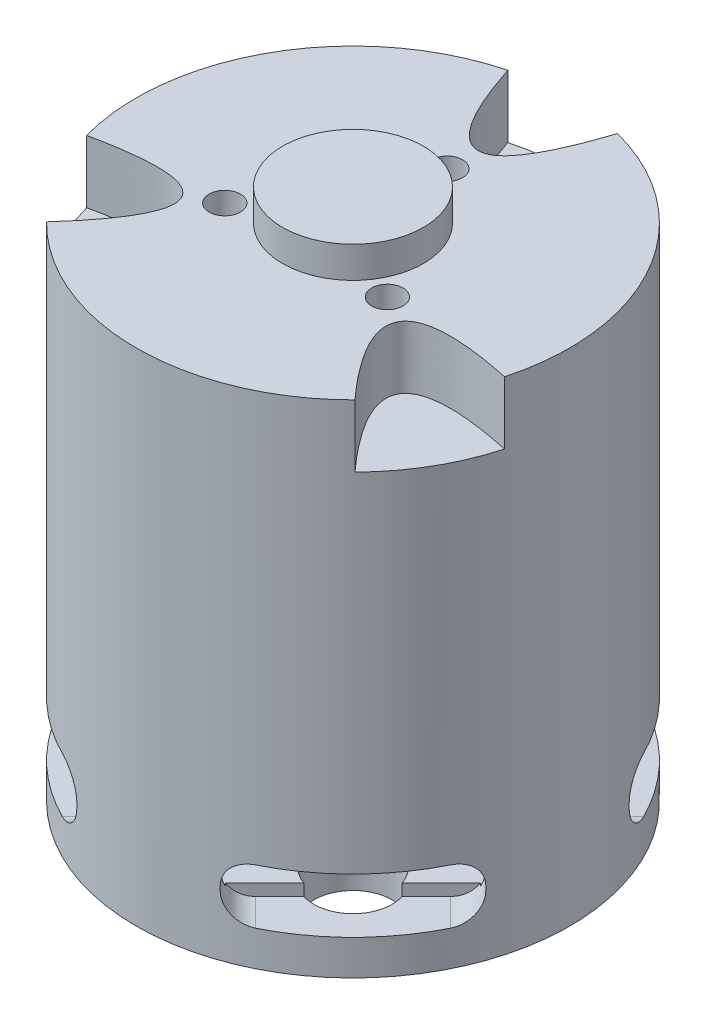
from build123d import *

# Parameters (mm, degrees)
SKETCH1_R           = 13.85
SKETCH1_R_2         = 1.5
SKETCH1_R_3         = 2.5
BOSS_EXTRUDE1_DEPTH = 3
SKETCH2_R           = 13.85
SKETCH2_R_2         = 12.35
BOSS_EXTRUDE2_DEPTH = 4
CUT_EXTRUDE1_DEPTH  = 3.2
CIRPATTERN1_COUNT   = 4
SKETCH4_R           = 13.85
BOSS_EXTRUDE3_DEPTH = 25
CUT_EXTRUDE2_START  = -4
SKETCH5_R           = 1
CUT_EXTRUDE2_DEPTH  = 4
SKETCH6_R           = 4.5
BOSS_EXTRUDE4_DEPTH = 2
SKETCH7_R           = 1.585
BOSS_EXTRUDE5_DEPTH = 2


with BuildPart() as part:
    # Sketch1 → Boss-Extrude1 (new body)
    with BuildSketch(Plane(origin=(0, 0, 0), x_dir=(1, 0, 0), z_dir=(0, 1, 0))):
        Circle(SKETCH1_R)
        with Locations((0, 8)):
            Circle(SKETCH1_R_2, mode=Mode.SUBTRACT)
        with Locations((-9.5, 0)):
            Circle(SKETCH1_R_2, mode=Mode.SUBTRACT)
        with Locations((-6.717514421, 6.717514421)):
            Circle(SKETCH1_R_3, mode=Mode.SUBTRACT)
        with Locations((6.717514421, 6.717514421)):
            Circle(SKETCH1_R_3, mode=Mode.SUBTRACT)
        with Locations((9.5, 0)):
            Circle(SKETCH1_R_2, mode=Mode.SUBTRACT)
        with Locations((6.717514421, -6.717514421)):
            Circle(SKETCH1_R_3, mode=Mode.SUBTRACT)
        with Locations((0, -8)):
            Circle(SKETCH1_R_2, mode=Mode.SUBTRACT)
        with Locations((-6.717514421, -6.717514421)):
            Circle(SKETCH1_R_3, mode=Mode.SUBTRACT)
    extrude(amount=BOSS_EXTRUDE1_DEPTH)

    # Sketch2 → Boss-Extrude2 (add)
    with BuildSketch(Plane(origin=(0, 3, 0), x_dir=(1, 0, 0), z_dir=(0, 1, 0))):
        Circle(SKETCH2_R)
        Circle(SKETCH2_R_2, mode=Mode.SUBTRACT)
    extrude(amount=BOSS_EXTRUDE2_DEPTH)

    # Sketch3 → Cut-Extrude1 (cut)
    with BuildSketch(Plane(origin=(-9.793428919, 0, 9.793428919), x_dir=(0, -1, 0), z_dir=(-0.7071067811865488, 0, 0.7071067811865464))):
        with BuildLine():
            Line((-4.15, 6), (-3.85, 6))
            ThreePointArc((-3.85, 6), (-2.71862915, 5.53137085), (-2.25, 4.4))
            Line((-2.25, 4.4), (-2.25, -4.4))
            ThreePointArc((-2.25, -4.4), (-2.71862915, -5.53137085), (-3.85, -6))
            Line((-3.85, -6), (-4.15, -6))
            ThreePointArc((-4.15, -6), (-5.28137085, -5.53137085), (-5.75, -4.4))
            Line((-5.75, -4.4), (-5.75, 4.4))
            ThreePointArc((-5.75, 4.4), (-5.28137085, 5.53137085), (-4.15, 6))
        make_face()
    cut_extrude1 = extrude(amount=-CUT_EXTRUDE1_DEPTH, mode=Mode.SUBTRACT)

    # CirPattern1: Cut-Extrude1 ×4 about axis
    cirpattern1_axis = Axis((0, 7, 0), (0, -1, 0))
    for i in range(1, CIRPATTERN1_COUNT):
        add(cut_extrude1.rotate(cirpattern1_axis, i * 360 / CIRPATTERN1_COUNT), mode=Mode.SUBTRACT)

    # Sketch4 → Boss-Extrude3 (add)
    with BuildSketch(Plane(origin=(0, 7, 0), x_dir=(1, 0, 0), z_dir=(0, 1, 0))):
        Circle(SKETCH4_R)
    extrude(amount=BOSS_EXTRUDE3_DEPTH)

    # Sketch5 → Cut-Extrude2 (cut)
    with BuildSketch(Plane(origin=(0, 32, 0), x_dir=(1, 0, 0), z_dir=(0, 1, 0)).offset(CUT_EXTRUDE2_START)):
        with Locations((0, 6)):
            Circle(SKETCH5_R)
        with Locations((5.196152423, -3)):
            Circle(SKETCH5_R)
        with Locations((-5.196152423, -3)):
            Circle(SKETCH5_R)
        with BuildLine():
            ThreePointArc((-13.355144333, -3.669144292), (-11.994451842, -6.925), (-9.855144333, -9.731322118))
            add(Edge.make_bspline(
                [(-9.855144333, -9.731322118), (-2.251262127, -1.299766795), (-13.355144333, -3.669144292)],
                knots=[0, 0, 0, 1, 1, 1], degree=2))
        make_face()
        with BuildLine():
            ThreePointArc((3.5, 13.40046641), (0, 13.85), (-3.5, 13.40046641))
            add(Edge.make_bspline(
                [(-3.5, 13.40046641), (0, 2.59953359), (3.5, 13.40046641)],
                knots=[0, 0, 0, 1, 1, 1], degree=2))
        make_face()
        with BuildLine():
            ThreePointArc((9.855144333, -9.731322118), (11.994451842, -6.925), (13.355144333, -3.669144292))
            add(Edge.make_bspline(
                [(13.355144333, -3.669144292), (2.251262127, -1.299766795), (9.855144333, -9.731322118)],
                knots=[0, 0, 0, 1, 1, 1], degree=2))
        make_face()
    extrude(amount=CUT_EXTRUDE2_DEPTH, mode=Mode.SUBTRACT)

    # Sketch6 → Boss-Extrude4 (add)
    with BuildSketch(Plane(origin=(0, 32, 0), x_dir=(1, 0, 0), z_dir=(0, 1, 0))):
        Circle(SKETCH6_R)
    extrude(amount=BOSS_EXTRUDE4_DEPTH)

    # Sketch7 → Boss-Extrude5 (add)
    with BuildSketch(Plane.XZ):
        Circle(SKETCH7_R)
    extrude(amount=BOSS_EXTRUDE5_DEPTH)


solid = part.part
